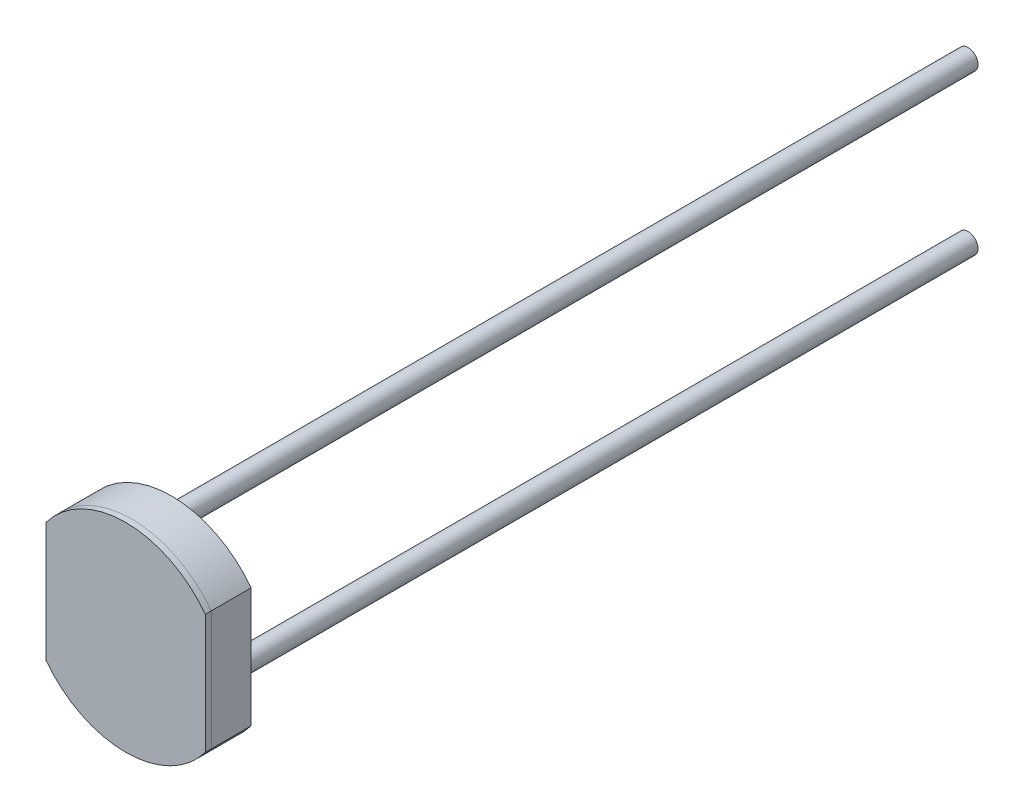
from build123d import *

# Parameters (mm, degrees)
BOSS_EXTRUDE1_DEPTH = 1
SKETCH3_R           = 0.25
BOSS_EXTRUDE2_DEPTH = 0.1
FILLET1_R           = 0.2
BOSS_EXTRUDE3_DEPTH = 0.15
SKETCH5_R           = 0.25
BOSS_EXTRUDE4_DEPTH = 20


with BuildPart() as part:
    # Sketch1 → Boss-Extrude1 (new body)
    with BuildSketch(Plane.XY):
        with BuildLine():
            Line((-2, 1.5), (-2, -1.5))
            ThreePointArc((-2, -1.5), (0, -2.5), (2, -1.5))
            Line((2, -1.5), (2, 1.5))
            ThreePointArc((2, 1.5), (0, 2.5), (-2, 1.5))
        make_face()
    extrude(amount=BOSS_EXTRUDE1_DEPTH)

    # Sketch3 → Boss-Extrude2 (add)
    with BuildSketch(Plane.XY.offset(1)):
        with BuildLine():
            ThreePointArc((0.3, 1), (0, 1.3), (-0.3, 1))
            Line((-0.3, 1), (-0.3, 0))
            Line((-0.3, 0), (-0.3, -1))
            ThreePointArc((-0.3, -1), (-0.6, -1.3), (-0.9, -1))
            Line((-0.9, -1), (-0.9, 1))
            ThreePointArc((-0.9, 1), (-1.2, 1.3), (-1.5, 1))
            Line((-1.5, 1), (-1.5, 0))
            ThreePointArc((-1.5, 0), (-1.646446609, -0.353553391), (-2, -0.5))
            Line((-2, -0.5), (-2, -0.6))
            ThreePointArc((-2, -0.6), (-1.575735931, -0.424264069), (-1.4, 0))
            Line((-1.4, 0), (-1.4, 1))
            ThreePointArc((-1.4, 1), (-1.2, 1.2), (-1, 1))
            Line((-1, 1), (-1, -1))
            ThreePointArc((-1, -1), (-0.6, -1.4), (-0.2, -1))
            Line((-0.2, -1), (-0.2, 0))
            Line((-0.2, 0), (-0.2, 1))
            ThreePointArc((-0.2, 1), (0, 1.2), (0.2, 1))
            Line((0.2, 1), (0.2, 0))
            Line((0.2, 0), (0.2, -1))
            ThreePointArc((0.2, -1), (0.6, -1.4), (1, -1))
            Line((1, -1), (1, 1))
            ThreePointArc((1, 1), (1.2, 1.2), (1.4, 1))
            Line((1.4, 1), (1.4, 0))
            ThreePointArc((1.4, 0), (1.575735931, -0.424264069), (2, -0.6))
            Line((2, -0.6), (2, -0.5))
            ThreePointArc((2, -0.5), (1.646446609, -0.353553391), (1.5, 0))
            Line((1.5, 0), (1.5, 1))
            ThreePointArc((1.5, 1), (1.2, 1.3), (0.9, 1))
            Line((0.9, 1), (0.9, -1))
            ThreePointArc((0.9, -1), (0.6, -1.3), (0.3, -1))
            Line((0.3, -1), (0.3, 0))
            Line((0.3, 0), (0.3, 1))
        make_face()
        with BuildLine():
            Line((-0.3, 0), (-0.3, 1))
            ThreePointArc((-0.3, 1), (0, 1.3), (0.3, 1))
            Line((0.3, 1), (0.3, 0))
            Line((0.3, 0), (0.3, -1))
            ThreePointArc((0.3, -1), (0.6, -1.3), (0.9, -1))
            Line((0.9, -1), (0.9, 1))
            ThreePointArc((0.9, 1), (1.2, 1.3), (1.5, 1))
            Line((1.5, 1), (1.5, 0))
            ThreePointArc((1.5, 0), (1.646446609, -0.353553391), (2, -0.5))
            Line((2, -0.5), (2, -0.4))
            ThreePointArc((2, -0.4), (1.717157288, -0.282842712), (1.6, 0))
            Line((1.6, 0), (1.6, 1))
            ThreePointArc((1.6, 1), (1.2, 1.4), (0.8, 1))
            Line((0.8, 1), (0.8, -1))
            ThreePointArc((0.8, -1), (0.6, -1.2), (0.4, -1))
            Line((0.4, -1), (0.4, 0))
            Line((0.4, 0), (0.4, 1))
            ThreePointArc((0.4, 1), (0, 1.4), (-0.4, 1))
            Line((-0.4, 1), (-0.4, 0))
            Line((-0.4, 0), (-0.4, -1))
            ThreePointArc((-0.4, -1), (-0.6, -1.2), (-0.8, -1))
            Line((-0.8, -1), (-0.8, 1))
            ThreePointArc((-0.8, 1), (-1.2, 1.4), (-1.6, 1))
            Line((-1.6, 1), (-1.6, 0))
            ThreePointArc((-1.6, 0), (-1.717157288, -0.282842712), (-2, -0.4))
            Line((-2, -0.4), (-2, -0.5))
            ThreePointArc((-2, -0.5), (-1.646446609, -0.353553391), (-1.5, 0))
            Line((-1.5, 0), (-1.5, 1))
            ThreePointArc((-1.5, 1), (-1.2, 1.3), (-0.9, 1))
            Line((-0.9, 1), (-0.9, -1))
            ThreePointArc((-0.9, -1), (-0.6, -1.3), (-0.3, -1))
            Line((-0.3, -1), (-0.3, 0))
        make_face()
        with Locations((0, -2)):
            Circle(SKETCH3_R)
        with Locations((0, 2)):
            Circle(SKETCH3_R)
    extrude(amount=BOSS_EXTRUDE2_DEPTH)

    # Fillet1
    # the kernel refuses this fillet: 0.2 mm, written as the material it takes off along each edge
    with BuildSketch(Plane(origin=(0, -2, 1.1), x_dir=(1, 0, 0), z_dir=(0, -1, 0))) as fillet1_piece_1:
        with BuildLine():
            CenterArc((0.076794919, -0.2), FILLET1_R, 30, 60)
            Line((0.076794919, 0), (0.076794919, 0.004))
            Line((0.076794919, 0.004), (0.25, 0.004))
            Line((0.25, 0.004), (0.254, 0))
            ThreePointArc((0.254, 0), (0.254, -0.05), (0.253464102, -0.098))
            Line((0.253464102, -0.098), (0.25, -0.1))
        make_face()
    revolve(axis=Axis((0, -2, 1.1), (0, 0, 1)), mode=Mode.SUBTRACT)
    with BuildSketch(Plane(origin=(0, 2, 1.1), x_dir=(1, 0, 0), z_dir=(0, -1, 0))) as fillet1_piece_2:
        with BuildLine():
            CenterArc((0.076794919, -0.2), FILLET1_R, 30, 60)
            Line((0.076794919, 0), (0.076794919, 0.004))
            Line((0.076794919, 0.004), (0.25, 0.004))
            Line((0.25, 0.004), (0.254, 0))
            ThreePointArc((0.254, 0), (0.254, -0.05), (0.253464102, -0.098))
            Line((0.253464102, -0.098), (0.25, -0.1))
        make_face()
    revolve(axis=Axis((0, 2, 1.1), (0, 0, 1)), mode=Mode.SUBTRACT)

    # Sketch5 → Boss-Extrude4 (add)
    with BuildSketch(Plane(origin=(0, 0, 0), x_dir=(-1, 0, 0), z_dir=(0, 0, -1))):
        with Locations(Location((0, 2, 0), (0, 0, 180))):
            Circle(SKETCH5_R)
        with Locations(Location((0, -2, 0), (0, 0, 180))):
            Circle(SKETCH5_R)
    extrude(amount=BOSS_EXTRUDE4_DEPTH)


with BuildPart() as body_2:
    # Sketch4 → Boss-Extrude3 (new body)
    with BuildSketch(Plane.XY.offset(1)):
        with BuildLine():
            Line((-2, -0.4), (-2, -0.6))
            Line((-2, -0.6), (-2, -1.5))
            ThreePointArc((-2, -1.5), (0, -2.5), (2, -1.5))
            Line((2, -1.5), (2, -0.6))
            Line((2, -0.6), (2, -0.4))
            Line((2, -0.4), (2, 1.5))
            ThreePointArc((2, 1.5), (0, 2.5), (-2, 1.5))
            Line((-2, 1.5), (-2, -0.4))
        make_face()
    extrude(amount=BOSS_EXTRUDE3_DEPTH)


solid = Compound([part.part, body_2.part])
